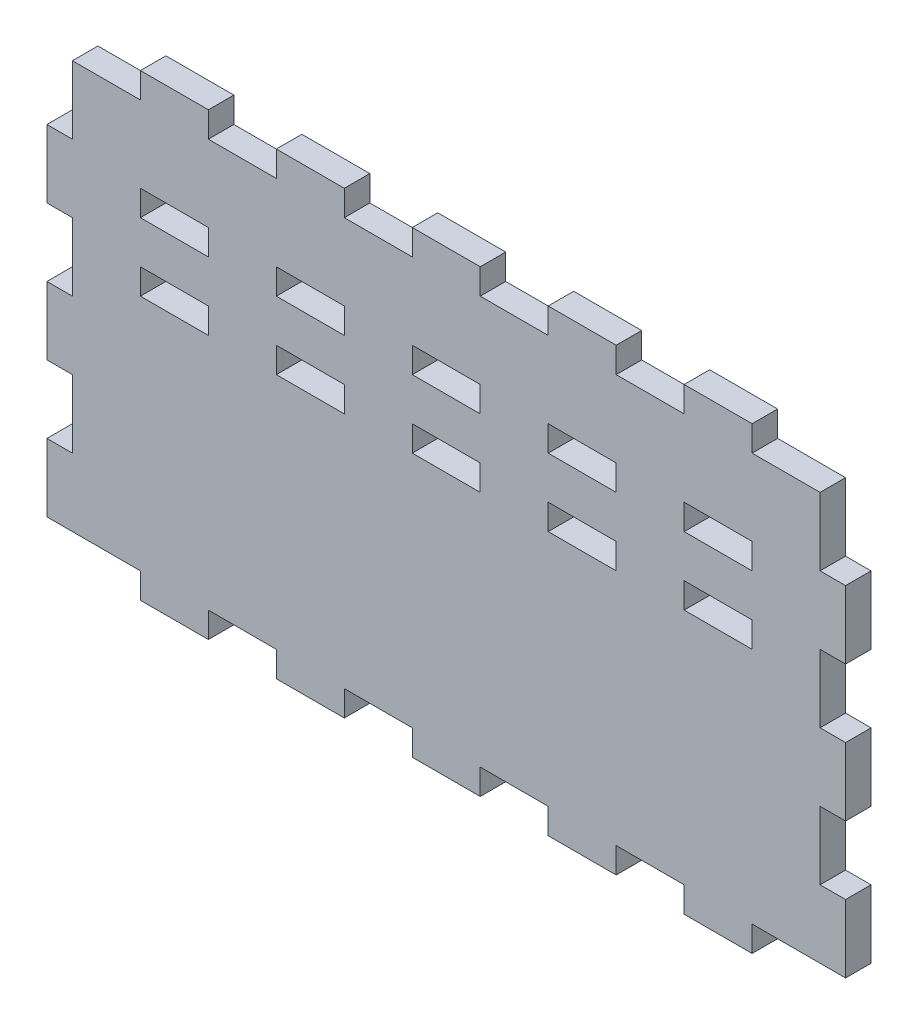
from build123d import *

# Parameters (mm, degrees)
SKETCH1_W               = 279.4
SKETCH1_H               = 152.4
BOSS_EXTRUDE1_DEPTH     = 9.525
SKETCH2_W               = 25.4
SKETCH2_H               = 9.525
BOSS_EXTRUDE2_DEPTH     = 9.525
LPATTERN1_COUNT         = 5
LPATTERN1_PITCH         = 50.8
MIRROR1_COPY_1_SKETCH_W = 25.4
MIRROR1_COPY_1_SKETCH_H = 9.525
MIRROR1_COPY_1_DEPTH    = 9.525
MIRROR1_COPY_2_SKETCH_W = 25.4
MIRROR1_COPY_2_SKETCH_H = 9.525
MIRROR1_COPY_2_DEPTH    = 9.525
MIRROR1_COPY_3_SKETCH_W = 25.4
MIRROR1_COPY_3_SKETCH_H = 9.525
MIRROR1_COPY_3_DEPTH    = 9.525
MIRROR1_COPY_4_SKETCH_W = 25.4
MIRROR1_COPY_4_SKETCH_H = 9.525
MIRROR1_COPY_4_DEPTH    = 9.525
MIRROR1_COPY_5_SKETCH_W = 25.4
MIRROR1_COPY_5_SKETCH_H = 9.525
MIRROR1_COPY_5_DEPTH    = 9.525
SKETCH3_W               = 9.525
SKETCH3_H               = 25.4
BOSS_EXTRUDE3_DEPTH     = 9.525
LPATTERN2_COUNT         = 3
LPATTERN2_PITCH         = 50.8
MIRROR2_COPY_1_SKETCH_W = 9.525
MIRROR2_COPY_1_SKETCH_H = 25.4
MIRROR2_COPY_1_DEPTH    = 9.525
MIRROR2_COPY_2_SKETCH_W = 9.525
MIRROR2_COPY_2_SKETCH_H = 25.4
MIRROR2_COPY_2_DEPTH    = 9.525
MIRROR2_COPY_3_SKETCH_W = 9.525
MIRROR2_COPY_3_SKETCH_H = 25.4
MIRROR2_COPY_3_DEPTH    = 9.525
SKETCH4_W               = 25.4
SKETCH4_H               = 9.525
CUT_EXTRUDE1_DEPTH      = 173.358933261
LPATTERN3_COUNT         = 5
LPATTERN3_PITCH         = 50.8


with BuildPart() as part:
    # Sketch1 → Boss-Extrude1 (new body)
    with BuildSketch(Plane.XY):
        Rectangle(SKETCH1_W, SKETCH1_H)
    extrude(amount=BOSS_EXTRUDE1_DEPTH)

    # Sketch2 → Boss-Extrude2 (add)
    with BuildSketch(Plane.XZ.offset(76.2)):
        with Locations((-101.6, 4.7625)):
            Rectangle(SKETCH2_W, SKETCH2_H)
    boss_extrude2 = extrude(amount=BOSS_EXTRUDE2_DEPTH)

    # LPattern1: Boss-Extrude2 ×5
    with Locations(*[(i * LPATTERN1_PITCH, 0, 0) for i in range(1, LPATTERN1_COUNT)]):
        add(boss_extrude2)

    # Mirror1 copy 1 sketch → Mirror1 copy 1 (add)
    with BuildSketch(Plane(origin=(50.8, 76.2, 0), x_dir=(1, 0, 0), z_dir=(0, 1, 0))):
        with Locations((-101.6, -4.7625)):
            Rectangle(MIRROR1_COPY_1_SKETCH_W, MIRROR1_COPY_1_SKETCH_H)
    extrude(amount=MIRROR1_COPY_1_DEPTH)

    # Mirror1 copy 2 sketch → Mirror1 copy 2 (add)
    with BuildSketch(Plane(origin=(101.6, 76.2, 0), x_dir=(1, 0, 0), z_dir=(0, 1, 0))):
        with Locations((-101.6, -4.7625)):
            Rectangle(MIRROR1_COPY_2_SKETCH_W, MIRROR1_COPY_2_SKETCH_H)
    extrude(amount=MIRROR1_COPY_2_DEPTH)

    # Mirror1 copy 3 sketch → Mirror1 copy 3 (add)
    with BuildSketch(Plane(origin=(152.4, 76.2, 0), x_dir=(1, 0, 0), z_dir=(0, 1, 0))):
        with Locations((-101.6, -4.7625)):
            Rectangle(MIRROR1_COPY_3_SKETCH_W, MIRROR1_COPY_3_SKETCH_H)
    extrude(amount=MIRROR1_COPY_3_DEPTH)

    # Mirror1 copy 4 sketch → Mirror1 copy 4 (add)
    with BuildSketch(Plane(origin=(203.2, 76.2, 0), x_dir=(1, 0, 0), z_dir=(0, 1, 0))):
        with Locations((-101.6, -4.7625)):
            Rectangle(MIRROR1_COPY_4_SKETCH_W, MIRROR1_COPY_4_SKETCH_H)
    extrude(amount=MIRROR1_COPY_4_DEPTH)

    # Mirror1 copy 5 sketch → Mirror1 copy 5 (add)
    with BuildSketch(Plane(origin=(0, 76.2, 0), x_dir=(1, 0, 0), z_dir=(0, 1, 0))):
        with Locations((-101.6, -4.7625)):
            Rectangle(MIRROR1_COPY_5_SKETCH_W, MIRROR1_COPY_5_SKETCH_H)
    extrude(amount=MIRROR1_COPY_5_DEPTH)

    # Sketch3 → Boss-Extrude3 (add)
    with BuildSketch(Plane(origin=(139.7, 0, 0), x_dir=(0, 0, -1), z_dir=(1, 0, 0))):
        with Locations((-4.7625, -63.5)):
            Rectangle(SKETCH3_W, SKETCH3_H)
    boss_extrude3 = extrude(amount=BOSS_EXTRUDE3_DEPTH)

    # LPattern2: Boss-Extrude3 ×3
    with Locations(*[(0, i * LPATTERN2_PITCH, 0) for i in range(1, LPATTERN2_COUNT)]):
        add(boss_extrude3)

    # Mirror2 copy 1 sketch → Mirror2 copy 1 (add)
    with BuildSketch(Plane(origin=(-139.7, 50.8, 0), x_dir=(0, 0, -1), z_dir=(-1, 0, 0))):
        with Locations((-4.7625, 63.5)):
            Rectangle(MIRROR2_COPY_1_SKETCH_W, MIRROR2_COPY_1_SKETCH_H)
    extrude(amount=MIRROR2_COPY_1_DEPTH)

    # Mirror2 copy 2 sketch → Mirror2 copy 2 (add)
    with BuildSketch(Plane(origin=(-139.7, 101.6, 0), x_dir=(0, 0, -1), z_dir=(-1, 0, 0))):
        with Locations((-4.7625, 63.5)):
            Rectangle(MIRROR2_COPY_2_SKETCH_W, MIRROR2_COPY_2_SKETCH_H)
    extrude(amount=MIRROR2_COPY_2_DEPTH)

    # Mirror2 copy 3 sketch → Mirror2 copy 3 (add)
    with BuildSketch(Plane(origin=(-139.7, 0, 0), x_dir=(0, 0, -1), z_dir=(-1, 0, 0))):
        with Locations((-4.7625, 63.5)):
            Rectangle(MIRROR2_COPY_3_SKETCH_W, MIRROR2_COPY_3_SKETCH_H)
    extrude(amount=MIRROR2_COPY_3_DEPTH)

    # Sketch4 → Cut-Extrude1 (cut, through all)
    with BuildSketch(Plane.XY.offset(9.525)):
        with Locations((-101.6, 17.4625)):
            Rectangle(SKETCH4_W, SKETCH4_H)
        with Locations((-101.6, 42.8625)):
            Rectangle(SKETCH4_W, SKETCH4_H)
    cut_extrude1 = extrude(amount=-CUT_EXTRUDE1_DEPTH, mode=Mode.SUBTRACT)

    # LPattern3: Cut-Extrude1 ×5
    with Locations(*[(i * LPATTERN3_PITCH, 0, 0) for i in range(1, LPATTERN3_COUNT)]):
        add(cut_extrude1, mode=Mode.SUBTRACT)


solid = part.part
